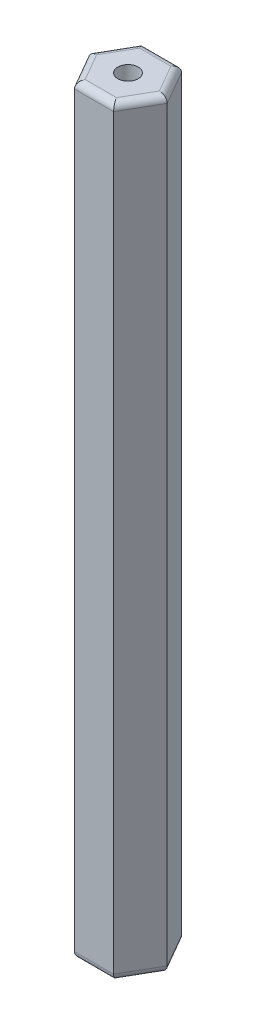
from build123d import *

# Parameters (mm, degrees)
RESSALTO_EXTRUS_O1_DEPTH = 56
FILETE1_R                = 0.5
ESBO_O2_R                = 0.751353762
CORTE_EXTRUS_O1_DEPTH    = 57.130057307


with BuildPart() as part:
    # Esboço1 → Ressalto-extrusão1 (new body)
    with BuildSketch(Plane.XZ.offset(30)):
        Polygon((-1.443375673, -2.5), (1.443375673, -2.5), (2.886751346, 0), (1.443375673, 2.5), (-1.443375673, 2.5), (-2.886751346, 0), align=None)
    extrude(amount=-RESSALTO_EXTRUS_O1_DEPTH)

    # Filete1
    filete1_edges = [part.edges().sort_by_distance(p)[0] for p in [
        (0, -30, 2.5),
        (2.165063509, -30, 1.25),
        (-2.165063509, -30, 1.25),
        (2.165063509, -30, -1.25),
        (-2.165063509, -30, -1.25),
        (0, -30, -2.5),
        (0, 26, 2.5),
        (2.165063509, 26, 1.25),
        (-2.165063509, 26, 1.25),
        (2.165063509, 26, -1.25),
        (-2.165063509, 26, -1.25),
        (0, 26, -2.5),
    ]]
    fillet(filete1_edges, radius=FILETE1_R)

    # Esboço2 → Corte-extrusão1 (cut, through all)
    with BuildSketch(Plane.XZ.offset(30)):
        Circle(ESBO_O2_R)
    extrude(amount=-CORTE_EXTRUS_O1_DEPTH, mode=Mode.SUBTRACT)


solid = part.part
